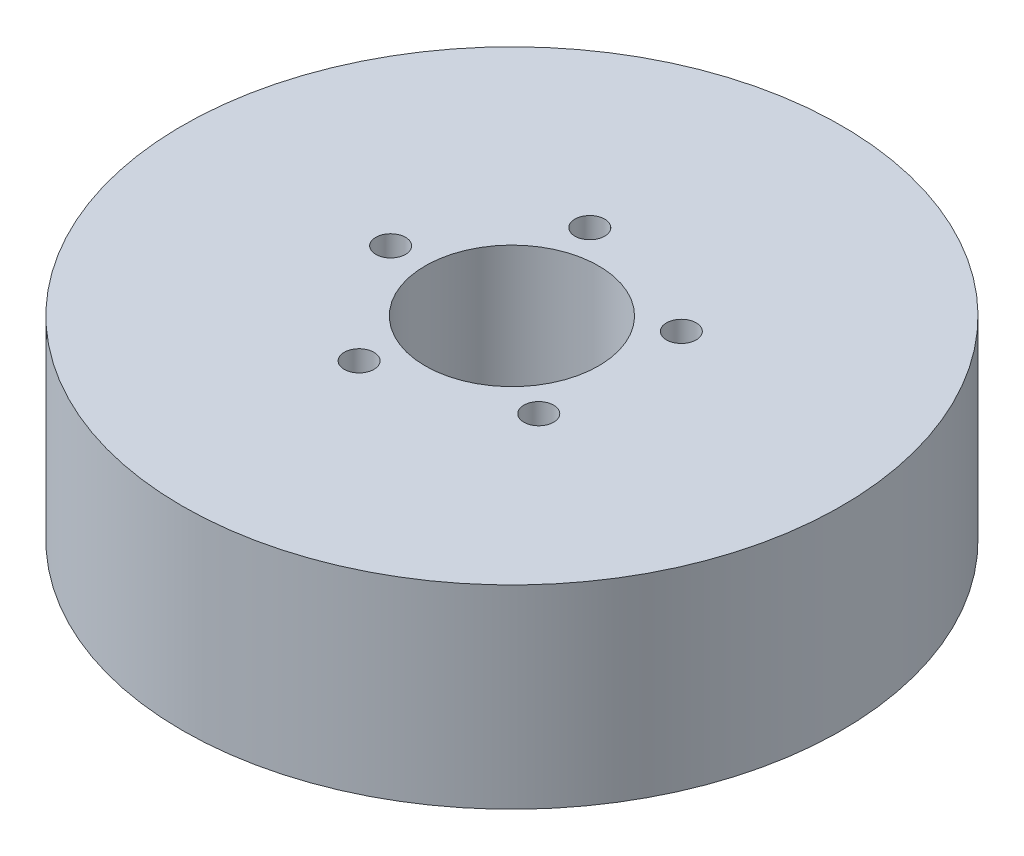
from build123d import *

# Parameters (mm, degrees)
SKETCH1_R           = 47.5
BOSS_EXTRUDE1_DEPTH = 28
SKETCH2_R           = 12.5
CUT_EXTRUDE1_DEPTH  = 73.777056824
SKETCH3_R           = 2.140973552
CUT_EXTRUDE2_DEPTH  = 19.468090771
CIRPATTERN1_COUNT   = 5


with BuildPart() as part:
    # Sketch1 → Boss-Extrude1 (new body)
    with BuildSketch(Plane(origin=(0, 0, 0), x_dir=(1, 0, 0), z_dir=(0, 1, 0))):
        Circle(SKETCH1_R)
    extrude(amount=BOSS_EXTRUDE1_DEPTH)

    # Sketch2 → Cut-Extrude1 (cut, through all)
    with BuildSketch(Plane(origin=(0, 0, 0), x_dir=(1, 0, 0), z_dir=(0, 1, 0))):
        Circle(SKETCH2_R)
    extrude(amount=CUT_EXTRUDE1_DEPTH, mode=Mode.SUBTRACT)

    # Sketch3 → Cut-Extrude2 (cut)
    with BuildSketch(Plane(origin=(0, 28, 0), x_dir=(1, 0, 0), z_dir=(0, 1, 0))):
        with Locations((-17.481110003, 0)):
            Circle(SKETCH3_R)
    cut_extrude2 = extrude(amount=-CUT_EXTRUDE2_DEPTH, mode=Mode.SUBTRACT)

    # CirPattern1: Cut-Extrude2 ×5 about axis
    cirpattern1_axis = Axis((0, 0, 0), (0, 1, 0))
    for i in range(1, CIRPATTERN1_COUNT):
        add(cut_extrude2.rotate(cirpattern1_axis, i * 360 / CIRPATTERN1_COUNT), mode=Mode.SUBTRACT)


solid = part.part
